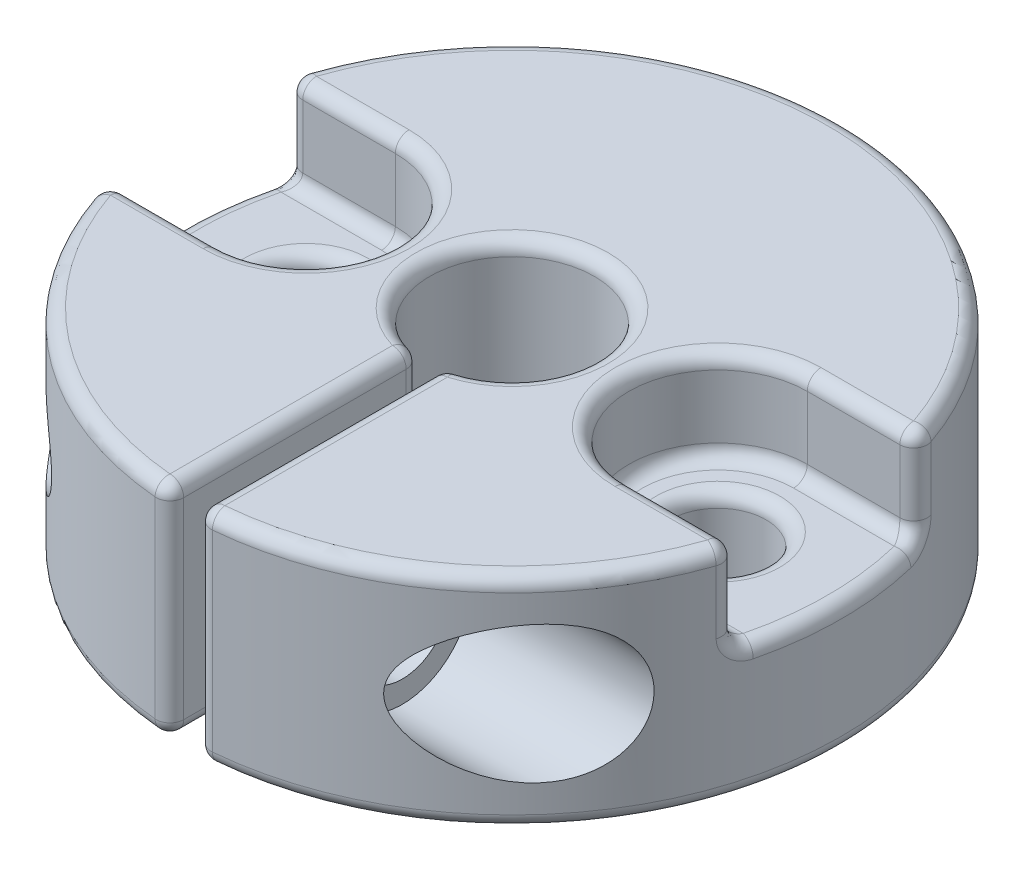
from build123d import *

# Parameters (mm, degrees)
SKETCH1_R           = 1.75
BOSS_EXTRUDE1_DEPTH = 8
CUT_EXTRUDE1_START  = -3.3
CUT_EXTRUDE1_DEPTH  = 3.3
SKETCH3_R           = 2.5000000000000004
CUT_EXTRUDE2_DEPTH  = 8
SKETCH4_R           = 1.7000000000000004
CUT_EXTRUDE3_DEPTH  = 22.540659395663827
FILLET1_R           = 0.5


with BuildPart() as part:
    # Sketch1 → Boss-Extrude1 (new body)
    with BuildSketch(Plane(origin=(0, 0, 0), x_dir=(1, 0, 0), z_dir=(0, 1, 0))):
        with BuildLine():
            ThreePointArc((12, 0), (-8.306623862918148, 8.660254037844316), (-0.49999999999979916, -11.989578808281808))
            Line((-0.5, -11.989578808281816), (-0.5, -2.9580398915498076))
            ThreePointArc((-0.5, -2.9580398915498085), (-8.9e-16, 3.000000000000001), (0.5000000000000007, -2.958039891549808))
            Line((0.5, -2.9580398915498076), (0.5, -11.989578808281811))
            ThreePointArc((0.49999999999983724, -11.989578808281806), (8.660254037844329, -8.306623862918135), (12, -2.94e-15))
        make_face()
        with Locations((-7.5, -1.73e-15)):
            Circle(SKETCH1_R, mode=Mode.SUBTRACT)
        with Locations((7.5, -1.73e-15)):
            Circle(SKETCH1_R, mode=Mode.SUBTRACT)
    extrude(amount=BOSS_EXTRUDE1_DEPTH)

    # Sketch2 → Cut-Extrude1 (cut)
    with BuildSketch(Plane(origin=(0, 8, 0), x_dir=(1, 0, 0), z_dir=(0, 1, 0)).offset(CUT_EXTRUDE1_START)):
        with BuildLine():
            Line((-7.5, 3.249999999999998), (-11.551515052147925, 3.2500000000000018))
            ThreePointArc((-11.551515052147925, 3.2500000000000018), (-12.000000000000004, 3.86e-15), (-11.551515052147925, -3.2500000000000013))
            Line((-11.551515052147925, -3.2500000000000013), (-7.5, -3.2500000000000013))
            ThreePointArc((-7.5, -3.2500000000000013), (-4.25, -1.73e-15), (-7.5, 3.249999999999998))
        make_face()
        with BuildLine():
            Line((7.5, -3.250000000000002), (11.551515052147925, -3.2500000000000027))
            ThreePointArc((11.551515052147925, -3.2500000000000027), (12.000000000000004, -1.33e-15), (11.551515052147925, 3.25))
            Line((11.551515052147925, 3.25), (7.5, 3.249999999999997))
            ThreePointArc((7.5, 3.249999999999997), (4.25, -2.26e-15), (7.5, -3.250000000000002))
        make_face()
    extrude(amount=CUT_EXTRUDE1_DEPTH, mode=Mode.SUBTRACT)

    # Sketch3 → Cut-Extrude2 (cut)
    with BuildSketch(Plane(origin=(12.000000000000002, 0, 0), x_dir=(0, 0, -1), z_dir=(1, 0, 0))):
        with Locations((-7.9947894041409, 3.9999999999999973)):
            Circle(SKETCH3_R)
    extrude(amount=-CUT_EXTRUDE2_DEPTH, mode=Mode.SUBTRACT)

    # Sketch4 → Cut-Extrude3 (cut, through all)
    with BuildSketch(Plane(origin=(4.000000000000002, 0, 0), x_dir=(0, 0, -1), z_dir=(1, 0, 0))):
        with Locations((-7.9947894041409, 3.9999999999999973)):
            Circle(SKETCH4_R)
    extrude(amount=-CUT_EXTRUDE3_DEPTH, mode=Mode.SUBTRACT)

    # Fillet1
    fillet1_edges = [part.edges().sort_by_distance(p)[0] for p in [
        (11.551515052147925, 6.35, -3.25),
        (11.551515052147925, 6.35, 3.2500000000000027),
        (-11.551515052147925, 6.35, 3.2500000000000004),
        (-11.551515052147925, 6.35, -3.2500000000000018),
        (0.5000000000000003, 4, 2.9580398915498076),
        (0.4999999999999186, 4, 11.98957880828181),
        (0.5, 3.9999999999999973, 9.6947894041409),
        (-0.4999999999998992, 4, 11.989578808281813),
        (-0.5, 4, 2.958039891549808),
        (-0.5, 3.9999999999999973, 9.6947894041409),
        (5.75, 4.7, 1.95e-15),
        (9.525757526073964, 4.7, -3.2499999999999982),
        (12.000000000000005, 4.7, 1.33e-15),
        (9.525757526073964, 4.7, 3.2500000000000027),
        (4.25, 4.7, 3.19e-15),
        (-9.525757526073964, 4.7, 3.2500000000000013),
        (-12.000000000000002, 4.7, -3.3e-16),
        (-9.525757526073964, 4.7, -3.25),
        (-4.25, 4.7, 1.25e-15),
        (-9.25, 4.7, 1.95e-15),
        (-9.4e-16, 0, -3.0000000000000013),
        (0.5, 0, 7.473809349915809),
        (-1.16e-14, 0, -12.000000000000004),
        (-0.5, 0, 7.473809349915812),
        (5.75, 0, 1.52e-15),
        (-9.25, 0, 1.52e-15),
        (-4.25, 8, 1.25e-15),
        (-9.525757526073964, 8, -3.25),
        (-5.38e-15, 8, -12),
        (9.525757526073964, 8, -3.2499999999999982),
        (4.25, 8, 3.19e-15),
        (9.525757526073964, 8, 3.2500000000000027),
        (7.443440951574654, 8, 9.412501622864214),
        (0.5, 8, 7.473809349915809),
        (-9.4e-16, 8, -3.0000000000000013),
        (-0.5, 8, 7.473809349915812),
        (-7.443440951574646, 8, 9.412501622864218),
        (-9.525757526073964, 8, 3.2500000000000013),
    ]]
    fillet(fillet1_edges, radius=FILLET1_R)


solid = part.part
